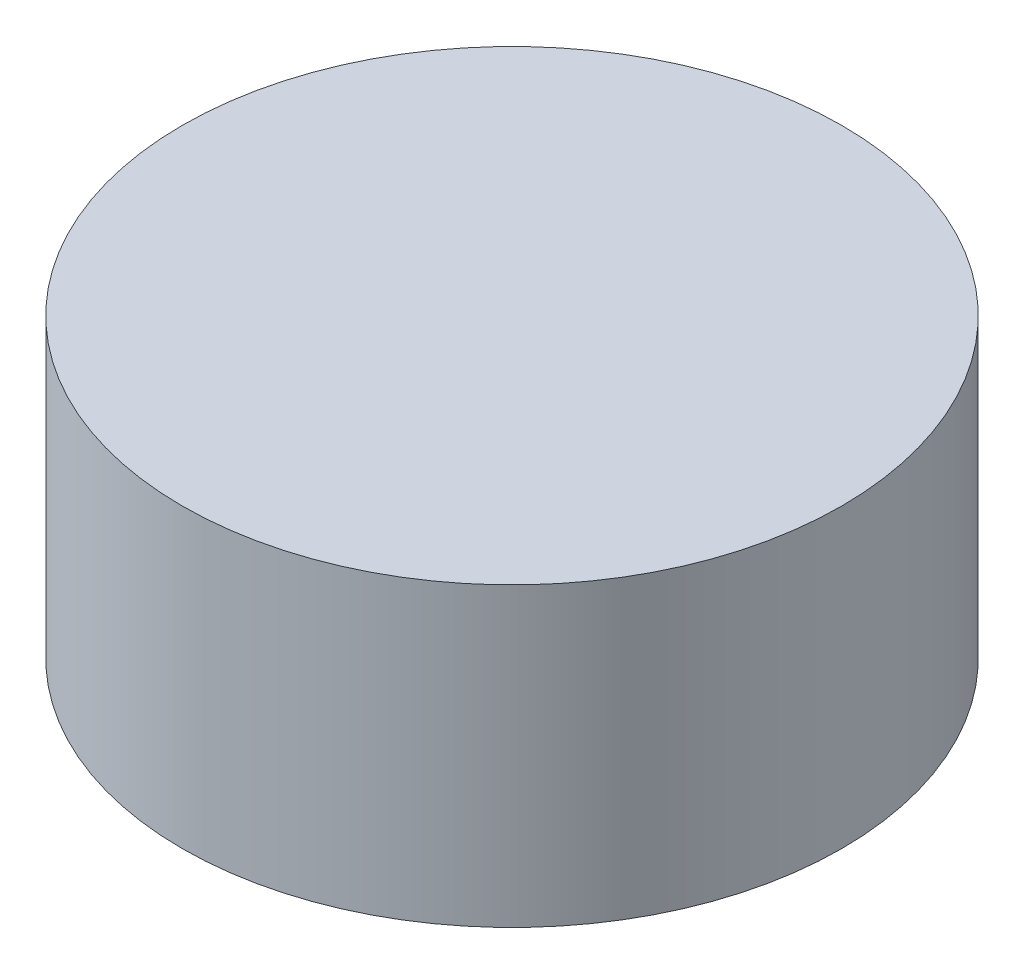
from build123d import *

# Parameters (mm, degrees)
SKETCH1_R           = 3
BOSS_EXTRUDE1_DEPTH = 2.7


with BuildPart() as part:
    # Sketch1 → Boss-Extrude1 (new body)
    with BuildSketch(Plane(origin=(0, 0, 0), x_dir=(1, 0, 0), z_dir=(0, 1, 0))):
        Circle(SKETCH1_R)
    extrude(amount=BOSS_EXTRUDE1_DEPTH)


solid = part.part
